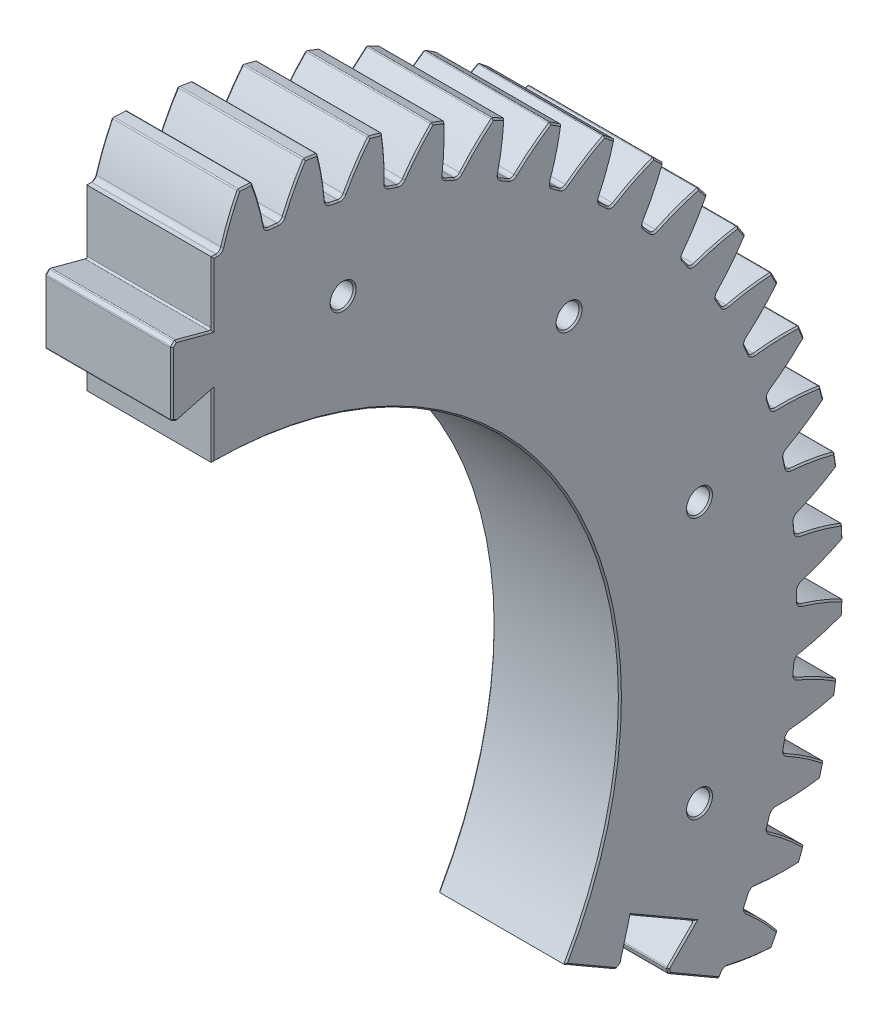
from build123d import *

# Parameters (mm, degrees)
BASPROSKE_W             = 25
BASPROSKE_H             = 124
TOOTHCUT_DEPTH          = 178.135541324
TEETHCUTS_COUNT         = 60
TEETHCUTS_ANGLE         = 354
BORSKE_R                = 80
BORE_DEPTH              = 50.0000508
ENL_V_MAT_EXTRU_1_DEPTH = 177.985481427
ESQUISSE3_R             = 2.25
ENL_V_MAT_EXTRU_2_DEPTH = 177.985481427
CONG_1_R                = 1
CHANFREIN1_SIZE         = 0.3
ESQUISSE4_R             = 6.75
ENL_V_MAT_EXTRU_3_DEPTH = 5.2
CHANFREIN2_SIZE         = 0.3
CHANFREIN3_SIZE         = 0.816496581
CHANFREIN3_SIZE_2       = 1
CONG_2_R                = 0.3
CHANFREIN4_SIZE         = 0.3
CONG_3_R                = 0.3


with BuildPart() as part:
    # BasProSke → Base-Revolve (revolve)
    with BuildSketch(Plane(origin=(0, 0, 0), x_dir=(1, 0, 0), z_dir=(0, 1, 0)), mode=Mode.PRIVATE) as base_revolve_sk:
        with Locations((12.5, 62)):
            Rectangle(BASPROSKE_W, BASPROSKE_H)
    revolve(base_revolve_sk.sketch.rotate(Axis((-10, 0, 0), (1, 0, 0)), 180), axis=Axis((-10, 0, 0), (1, 0, 0)))

    # TooCutSke → ToothCut (cut, through all)
    with BuildSketch(Plane(origin=(0, 0, 0), x_dir=(0, 0, -1), z_dir=(1, 0, 0))):
        with BuildLine():
            ThreePointArc((1.679508819, 114.986735109), (0, 114.999), (-1.679508819, 114.986735109))
            ThreePointArc((-1.679508819, 114.986735109), (-3.199847673, 119.539525214), (-5.167287996, 123.917710518))
            ThreePointArc((-5.167287996, 123.917710518), (0, 124.0254), (5.167287996, 123.917710518))
            ThreePointArc((5.167287996, 123.917710518), (3.199847673, 119.539525214), (1.679508819, 114.986735109))
        make_face()
    toothcut = extrude(amount=TOOTHCUT_DEPTH, mode=Mode.SUBTRACT)

    # TeethCuts: ToothCut ×60 about axis
    teethcuts_axis = Axis((-10, 0, 0), (1, 0, 0))
    for i in range(1, TEETHCUTS_COUNT):
        add(toothcut.rotate(teethcuts_axis, i * TEETHCUTS_ANGLE / (TEETHCUTS_COUNT - 1)), mode=Mode.SUBTRACT)

    # BorSke → Bore (cut, symmetric)
    with BuildSketch(Plane(origin=(0, 0, 0), x_dir=(0, 0, -1), z_dir=(1, 0, 0))):
        with Locations(Location((0, 0, 0), (0, 0, 180))):
            Circle(BORSKE_R)
    extrude(amount=BORE_DEPTH, both=True, mode=Mode.SUBTRACT)

    # Esquisse2 → Enlèv. mat.-Extru.1 (cut, through all)
    with BuildSketch(Plane(origin=(25, 0, 0), x_dir=(0, 0, -1), z_dir=(1, 0, 0))):
        Polygon((0, 114.999), (0, 102.5), (-8, 104.643593539), (-8, 90.356406461), (0, 92.5), (0, 0), (80.02074731, -46.2), (82.204533228, -38.05), (94.82042051, -45.333785918), (88.854206428, -51.3), (114.723136611, -66.235433804), (38.300830577, -156.661592329), (-106.341599395, -136.652334384), (-159.895789778, -12.477233605), (-109.242981723, 114.999), (0, 136.399070749), align=None)
    extrude(amount=-ENL_V_MAT_EXTRU_1_DEPTH, mode=Mode.SUBTRACT)

    # Esquisse3 → Enlèv. mat.-Extru.2 (cut, through all)
    with BuildSketch(Plane(origin=(25, 0, 0), x_dir=(0, 0, -1), z_dir=(1, 0, 0))):
        with Locations((25.623085465, 95.626656803)):
            Circle(ESQUISSE3_R)
        with Locations((70.003571337, 70.003571337)):
            Circle(ESQUISSE3_R)
        with Locations((95.626656803, 25.623085465)):
            Circle(ESQUISSE3_R)
        with Locations((95.626656803, -25.623085465)):
            Circle(ESQUISSE3_R)
    extrude(amount=-ENL_V_MAT_EXTRU_2_DEPTH, mode=Mode.SUBTRACT)

    # Congé1
    cong_1_edges = [part.edges().sort_by_distance(p)[0] for p in [
        (12.5, 114.986735109, -1.679508819),
        (12.5, -13.689695011, -114.181269267),
        (12.5, -10.349078424, -114.532382219),
        (12.5, -25.54989404, -112.124809545),
        (12.5, -22.264278997, -112.823188582),
        (12.5, -37.130163083, -108.839886946),
        (12.5, -33.93554747, -109.87788048),
        (12.5, -48.303626289, -104.362491769),
        (12.5, -45.235010984, -105.728727327),
        (12.5, -56.038870252, -100.421188112),
        (12.5, 114.181269267, -13.689695011),
        (12.5, 114.532382219, -10.349078424),
        (12.5, 112.124809545, -25.54989404),
        (12.5, 112.823188582, -22.264278997),
        (12.5, 108.839886946, -37.130163083),
        (12.5, 109.87788048, -33.93554747),
        (12.5, 104.362491769, -48.303626289),
        (12.5, 105.728727327, -45.235010984),
        (12.5, 84.327986441, -78.189262075),
        (12.5, 86.575607949, -75.693025499),
        (12.5, 75.693025499, -86.575607949),
        (12.5, 78.189262075, -84.327986441),
        (12.5, 98.741679294, -58.947864858),
        (12.5, 100.421188112, -56.038870252),
        (12.5, 92.039032317, -68.946258283),
        (12.5, 94.013413346, -66.22875593),
        (12.5, 56.038870252, -100.421188112),
        (12.5, 58.947864858, -98.741679294),
        (12.5, 66.22875593, -94.013413346),
        (12.5, 68.946258283, -92.039032317),
        (12.5, 45.235010984, -105.728727327),
        (12.5, 48.303626289, -104.362491769),
        (12.5, 33.93554747, -109.87788048),
        (12.5, 37.130163083, -108.839886946),
        (12.5, 22.264278997, -112.823188582),
        (12.5, 25.54989404, -112.124809545),
        (12.5, 10.349078424, -114.532382219),
        (12.5, 13.689695011, -114.181269267),
        (12.5, -1.679508819, -114.986735109),
        (12.5, 1.679508819, -114.986735109),
    ]]
    fillet(cong_1_edges, radius=CONG_1_R)

    # Chanfrein1
    chanfrein1_edges = [part.edges().sort_by_distance(p)[0] for p in [
        (25, 123.83006231, -6.489658574),
        (25, 40, -69.282032303),
        (0, 40, -69.282032303),
        (0, 114.998077734, -0.460563305),
        (25, 114.998077734, -0.460563305),
        (0, 86.25, 0),
        (0, -43.1, -74.651389806),
        (0, -42.125, -81.112640269),
        (0, -41.691892959, -88.512476869),
        (0, -48.316892959, -91.837313469),
        (0, -54.39975, -94.223130919),
        (0, 108.7495, 0),
        (0, 103.57179677, 4),
        (0, 97.5, 8),
        (0, 91.42820323, 4),
        (25, -54.39975, -94.223130919),
        (25, -48.316892959, -91.837313469),
        (25, -41.691892959, -88.512476869),
        (25, -42.125, -81.112640269),
        (25, -43.1, -74.651389806),
        (25, 86.25, 0),
        (25, 91.42820323, 4),
        (25, 97.5, 8),
        (25, 103.57179677, 4),
        (25, 108.7495, 0),
        (0, 95.626656803, -23.373085465),
        (25, 95.626656803, -23.373085465),
        (0, 70.003571337, -67.753571337),
        (25, 70.003571337, -67.753571337),
        (0, 25.623085465, -93.376656803),
        (25, 25.623085465, -93.376656803),
        (0, -25.623085465, -93.376656803),
        (25, -25.623085465, -93.376656803),
        (0, 119.877140989, -3.333168888),
        (25, 119.877140989, -3.333168888),
        (0, 119.568852489, -9.215663888),
        (0, 114.369023445, -12.020668747),
        (25, 114.369023445, -12.020668747),
        (0, 118.872030446, -15.845482769),
        (25, 118.872030446, -15.845482769),
        (0, 117.95054262, -21.663527922),
        (0, 112.485995937, -23.909636532),
        (25, 112.485995937, -23.909636532),
        (0, 116.564533062, -28.184190224),
        (25, 116.564533062, -28.184190224),
        (0, 115.039941924, -33.874041812),
        (0, 109.370548317, -35.536645336),
        (25, 109.370548317, -35.536645336),
        (0, 112.979930261, -40.214105794),
        (25, 112.979930261, -40.214105794),
        (0, 110.86893955, -45.71342461),
        (0, 105.056814083, -46.774307217),
        (25, 105.056814083, -46.774307217),
        (0, 108.157495701, -51.803427205),
        (25, 108.157495701, -51.803427205),
        (0, 105.483233874, -57.051961562),
        (0, 99.59205541, -57.4995),
        (25, 99.59205541, -57.4995),
        (0, 102.150064985, -62.825179427),
        (25, 102.150064985, -62.825179427),
        (0, 98.941831813, -67.765425285),
        (0, 93.036145336, -67.594716228),
        (25, 93.036145336, -67.594716228),
        (0, 95.023456781, -73.158605836),
        (25, 95.023456781, -73.158605836),
        (0, 91.316402338, -77.736436827),
        (0, 85.460911785, -76.949350601),
        (25, 85.460911785, -76.949350601),
        (0, 86.8557517, -82.69049125),
        (25, 86.8557517, -82.69049125),
        (0, 82.69049125, -86.8557517),
        (0, 76.949350601, -85.460911785),
        (25, 76.949350601, -85.460911785),
        (0, 77.736436827, -91.316402338),
        (25, 77.736436827, -91.316402338),
        (0, 73.158605836, -95.023456781),
        (0, 67.594716228, -93.036145336),
        (25, 67.594716228, -93.036145336),
        (0, 67.765425285, -98.941831813),
        (25, 67.765425285, -98.941831813),
        (0, 62.825179427, -102.150064985),
        (0, 57.4995, -99.59205541),
        (25, 57.4995, -99.59205541),
        (0, 57.051961562, -105.483233874),
        (25, 57.051961562, -105.483233874),
        (0, 51.803427205, -108.157495701),
        (0, 46.774307217, -105.056814083),
        (25, 46.774307217, -105.056814083),
        (0, 45.71342461, -110.86893955),
        (25, 45.71342461, -110.86893955),
        (0, 40.214105794, -112.979930261),
        (0, 35.536645336, -109.370548317),
        (25, 35.536645336, -109.370548317),
        (0, 33.874041812, -115.039941924),
        (25, 33.874041812, -115.039941924),
        (0, 28.184190224, -116.564533062),
        (0, 23.909636532, -112.485995937),
        (25, 23.909636532, -112.485995937),
        (0, 21.663527922, -117.95054262),
        (25, 21.663527922, -117.95054262),
        (0, 15.845482769, -118.872030446),
        (0, 12.020668747, -114.369023445),
        (25, 12.020668747, -114.369023445),
        (0, 9.215663888, -119.568852489),
        (25, 9.215663888, -119.568852489),
        (0, 3.333168888, -119.877140989),
        (0, 0, -114.999),
        (25, 0, -114.999),
        (0, -3.333168888, -119.877140989),
        (25, -3.333168888, -119.877140989),
        (0, -9.215663888, -119.568852489),
        (0, -12.020668747, -114.369023445),
        (25, -12.020668747, -114.369023445),
        (0, -15.845482769, -118.872030446),
        (25, -15.845482769, -118.872030446),
        (0, -21.663527922, -117.95054262),
        (0, -23.909636532, -112.485995937),
        (25, -23.909636532, -112.485995937),
        (0, -28.184190224, -116.564533062),
        (25, -28.184190224, -116.564533062),
        (0, -33.874041812, -115.039941924),
        (0, -35.536645336, -109.370548317),
        (25, -35.536645336, -109.370548317),
        (0, -40.214105794, -112.979930261),
        (25, -40.214105794, -112.979930261),
        (0, -57.051961562, -105.483233874),
        (0, -57.100179344, -99.821538356),
        (25, -57.100179344, -99.821538356),
        (0, -45.71342461, -110.86893955),
        (0, -46.774307217, -105.056814083),
        (25, -46.774307217, -105.056814083),
        (0, -51.803427205, -108.157495701),
        (25, -51.803427205, -108.157495701),
        (0, 115.191635289, -1.524239934),
        (25, 115.191635289, -1.524239934),
        (0, 114.719929916, -10.524914629),
        (25, 114.719929916, -10.524914629),
        (0, 114.401277, -13.556694607),
        (25, 114.401277, -13.556694607),
        (0, 112.991328985, -22.458756026),
        (25, 112.991328985, -22.458756026),
        (0, 112.357514381, -25.440619296),
        (25, 112.357514381, -25.440619296),
        (0, 110.024771408, -34.146534592),
        (25, 110.024771408, -34.146534592),
        (0, 109.082739321, -37.045811236),
        (25, 109.082739321, -37.045811236),
        (0, 105.852759411, -45.460196579),
        (25, 105.852759411, -45.460196579),
        (0, 104.612830943, -48.245121516),
        (25, 104.612830943, -48.245121516),
        (0, 100.521002431, -56.27578714),
        (25, 100.521002431, -56.27578714),
        (0, 98.996762497, -58.915848149),
        (25, 98.996762497, -58.915848149),
        (0, 94.087916313, -66.4748084),
        (25, 94.087916313, -66.4748084),
        (0, 92.296064804, -68.941080421),
        (25, 92.296064804, -68.941080421),
        (0, 86.623983295, -75.945517748),
        (25, 86.623983295, -75.945517748),
        (0, 84.584152112, -78.210979789),
        (25, 84.584152112, -78.210979789),
        (0, 78.210979789, -84.584152112),
        (25, 78.210979789, -84.584152112),
        (0, 75.945517748, -86.623983295),
        (25, 75.945517748, -86.623983295),
        (0, 68.941080421, -92.296064804),
        (25, 68.941080421, -92.296064804),
        (0, 66.4748084, -94.087916313),
        (25, 66.4748084, -94.087916313),
        (0, 58.915848149, -98.996762497),
        (25, 58.915848149, -98.996762497),
        (0, 56.27578714, -100.521002431),
        (25, 56.27578714, -100.521002431),
        (0, 48.245121516, -104.612830943),
        (25, 48.245121516, -104.612830943),
        (0, 45.460196579, -105.852759411),
        (25, 45.460196579, -105.852759411),
        (0, 37.045811236, -109.082739321),
        (25, 37.045811236, -109.082739321),
        (0, 34.146534592, -110.024771408),
        (25, 34.146534592, -110.024771408),
        (0, 25.440619296, -112.357514381),
        (25, 25.440619296, -112.357514381),
        (0, 22.458756026, -112.991328985),
        (25, 22.458756026, -112.991328985),
        (0, 13.556694607, -114.401277),
        (25, 13.556694607, -114.401277),
        (0, 10.524914629, -114.719929916),
        (25, 10.524914629, -114.719929916),
        (0, 1.524239934, -115.191635289),
        (25, 1.524239934, -115.191635289),
        (0, -1.524239934, -115.191635289),
        (25, -1.524239934, -115.191635289),
        (0, -10.524914629, -114.719929916),
        (25, -10.524914629, -114.719929916),
        (0, -13.556694607, -114.401277),
        (25, -13.556694607, -114.401277),
        (0, -22.458756026, -112.991328985),
        (25, -22.458756026, -112.991328985),
        (0, -25.440619296, -112.357514381),
        (25, -25.440619296, -112.357514381),
        (0, -34.146534592, -110.024771408),
        (25, -34.146534592, -110.024771408),
        (0, -37.045811236, -109.082739321),
        (25, -37.045811236, -109.082739321),
        (0, -56.27578714, -100.521002431),
        (25, -56.27578714, -100.521002431),
        (0, -45.460196579, -105.852759411),
        (25, -45.460196579, -105.852759411),
        (0, -48.245121516, -104.612830943),
        (25, -48.245121516, -104.612830943),
        (25, 122.473354234, -19.397873665),
        (25, 119.77480246, -32.093561593),
        (25, 115.763972886, -44.437625744),
        (25, 110.484808999, -56.294821968),
        (25, 103.995150425, -67.535240342),
        (25, 96.366099221, -78.03572849),
        (25, 87.681240867, -87.681240867),
        (25, 78.03572849, -96.366099221),
        (25, 67.535240342, -103.995150425),
        (25, 56.294821968, -110.484808999),
        (25, 44.437625744, -115.763972886),
        (25, 32.093561593, -119.77480246),
        (25, 19.397873665, -122.473354234),
        (25, 6.489658574, -123.83006231),
        (25, -6.489658574, -123.83006231),
        (25, -19.397873665, -122.473354234),
        (25, -32.093561593, -119.77480246),
        (25, -44.437625744, -115.763972886),
        (25, -56.294821968, -110.484808999),
        (0, 122.473354234, -19.397873665),
        (0, 119.77480246, -32.093561593),
        (0, 115.763972886, -44.437625744),
        (0, 110.484808999, -56.294821968),
        (0, 103.995150425, -67.535240342),
        (0, 96.366099221, -78.03572849),
        (0, 87.681240867, -87.681240867),
        (0, 78.03572849, -96.366099221),
        (0, 67.535240342, -103.995150425),
        (0, 56.294821968, -110.484808999),
        (0, 44.437625744, -115.763972886),
        (0, 32.093561593, -119.77480246),
        (0, 19.397873665, -122.473354234),
        (0, 6.489658574, -123.83006231),
        (0, -6.489658574, -123.83006231),
        (0, -19.397873665, -122.473354234),
        (0, -32.093561593, -119.77480246),
        (0, -44.437625744, -115.763972886),
        (0, -56.294821968, -110.484808999),
        (25, -9.215663888, -119.568852489),
        (25, -21.663527922, -117.95054262),
        (25, -33.874041812, -115.039941924),
        (25, -45.71342461, -110.86893955),
        (25, -57.051961562, -105.483233874),
        (25, 119.568852489, -9.215663888),
        (25, 117.95054262, -21.663527922),
        (25, 115.039941924, -33.874041812),
        (25, 110.86893955, -45.71342461),
        (25, 91.316402338, -77.736436827),
        (25, 82.69049125, -86.8557517),
        (25, 105.483233874, -57.051961562),
        (25, 98.941831813, -67.765425285),
        (25, 62.825179427, -102.150064985),
        (25, 73.158605836, -95.023456781),
        (25, 51.803427205, -108.157495701),
        (25, 40.214105794, -112.979930261),
        (25, 28.184190224, -116.564533062),
        (25, 15.845482769, -118.872030446),
        (25, 3.333168888, -119.877140989),
        (0, 123.83006231, -6.489658574),
    ]]
    chamfer(chanfrein1_edges, length=CHANFREIN1_SIZE)

    # Esquisse4 → Enlèv. mat.-Extru.3 (cut)
    with BuildSketch(Plane.ZY):
        with Locations((-95.626656803, -25.623085465)):
            Circle(ESQUISSE4_R)
        with Locations((-95.626656803, 25.623085465)):
            Circle(ESQUISSE4_R)
        with Locations((-70.003571337, 70.003571337)):
            Circle(ESQUISSE4_R)
        with Locations((-25.623085465, 95.626656803)):
            Circle(ESQUISSE4_R)
    extrude(amount=-ENL_V_MAT_EXTRU_3_DEPTH, mode=Mode.SUBTRACT)

    # Chanfrein2
    chanfrein2_edges = [part.edges().sort_by_distance(p)[0] for p in [
        (0, -25.623085465, -102.376656803),
        (0, 25.623085465, -102.376656803),
        (0, 70.003571337, -76.753571337),
        (0, 95.626656803, -32.373085465),
    ]]
    chamfer(chanfrein2_edges, length=CHANFREIN2_SIZE)

    # Chanfrein3
    # the kernel refuses this chamfer: 1, 0.816496581 mm, written as the material it takes off along each edge
    with BuildSketch(Plane(origin=(27.271682988, -46.2, -80.02074731), x_dir=(0, 0.46373866025064403, 0.8859720396202906), z_dir=(-1, 0, 0)), Plane(origin=(27.271682988, -51.3, -88.854206428), x_dir=(0, 0.7357588772160352, -0.6772435858668572), z_dir=(-1, 0, 0))) as chanfrein3_piece_1:
        Polygon((CHANFREIN3_SIZE * 0.999143623391, CHANFREIN3_SIZE * 0.0413765593125), (CHANFREIN3_SIZE_2 * 0.218630711303, CHANFREIN3_SIZE_2 * 0.975807671662), (0, 0), align=None)
    extrude(amount=29.543365976, mode=Mode.SUBTRACT)
    with BuildSketch(Plane(origin=(27.271682988, 90.356406461, 8), x_dir=(0, 0.23216221266391973, -0.9726770825978132), z_dir=(-1, 0, 0)), Plane(origin=(27.271682988, 104.643593539, 8), x_dir=(0, -0.9996219169112968, 0.02749587661058574), z_dir=(-1, 0, 0))) as chanfrein3_piece_2:
        Polygon((CHANFREIN3_SIZE_2 * 0.999621916911, -CHANFREIN3_SIZE_2 * 0.0274958766106), (CHANFREIN3_SIZE * 0.232162212643, -CHANFREIN3_SIZE * 0.972677082512), (0, 0), align=None)
    extrude(amount=29.543365976, mode=Mode.SUBTRACT)

    # Congé2
    cong_2_edges = [part.edges().sort_by_distance(p)[0] for p in [
        (12.5, 92.5, 0),
        (12.5, 102.5, 0),
        (12.5, -45.333785918, -94.82042051),
        (12.5, -38.05, -82.204533228),
        (12.5, -45.79175171, -79.313640528),
        (12.5, -45.234074174, -80.279566355),
        (12.5, -50.722649731, -89.431556697),
        (12.5, -51.8, -89.720231832),
        (12.5, 103.643593539, 8),
        (12.5, 91.172903041, 8),
        (12.5, 90.615225506, 7.034074174),
        (12.5, 104.432268674, 7.211324865),
    ]]
    fillet(cong_2_edges, radius=CONG_2_R)

    # Chanfrein4
    # the kernel refuses this chamfer: 0.3 mm, written as the material it takes off along each edge
    with BuildSketch(Plane(origin=(0, -52.135408883, -89.810104372), x_dir=(-0.027495876610585814, 0.2587211899982335, -0.9655606260692869), z_dir=(0, 0.9659258262891487, 0.25881904510222103)), Plane(origin=(0, -45.06045376, -80.580285733), x_dir=(-0.027495876610586938, 0.8656979742251878, 0.49981095845511586), z_dir=(0, -0.4999999999994673, 0.8660254037847464)), Plane(origin=(25, 90.441605092, 6.733354796), x_dir=(-0.9996219169112971, -0.023812127644076485, 0.013747938305288431), z_dir=(0, 0.5000000000000858, 0.8660254037843892)), Plane(origin=(25, 103.398057195, 8.245536344), x_dir=(-0.999621916911297, 0.01944252080602017, 0.0194425208059982), z_dir=(0, 0.707106781186148, -0.707106781186947))) as chanfrein4_piece_1:
        Polygon((CHANFREIN4_SIZE * 0.999621916911, -CHANFREIN4_SIZE * 0.0274958766106), (-CHANFREIN4_SIZE * 0.0274958766106, -CHANFREIN4_SIZE * 0.999621916911), (0, 0), align=None)
    extrude(amount=1.887690634, mode=Mode.SUBTRACT)
    with BuildSketch(Plane(origin=(25, -50.312039748, -89.321534084), x_dir=(-0.9996219169112962, -0.007116456528604932, 0.026558977334641815), z_dir=(0, -0.9659258262891487, -0.25881904510222103)), Plane(origin=(25, -46.004299077, -78.945497689), x_dir=(-0.9996219169112968, -0.023812127644094662, -0.013747938305276252), z_dir=(0, 0.4999999999994673, -0.8660254037847464)), Plane(origin=(0, 91.385450409, 8.368142839), x_dir=(-0.02749587661058581, 0.8656979742248309, -0.4998109584557341), z_dir=(0, -0.5000000000000858, -0.8660254037843892)), Plane(origin=(0, 104.732856044, 6.910737496), x_dir=(-0.027495876610586348, -0.7068394360710728, -0.7068394360702741), z_dir=(0, -0.707106781186148, 0.707106781186947))) as chanfrein4_piece_2:
        Polygon((CHANFREIN4_SIZE * 0.999621916911, CHANFREIN4_SIZE * 0.0274958766106), (-CHANFREIN4_SIZE * 0.0274958766106, CHANFREIN4_SIZE * 0.999621916911), (0, 0), align=None)
    extrude(amount=1.887690634, mode=Mode.SUBTRACT)

    # Congé3
    cong_3_edges = [part.edges().sort_by_distance(p)[0] for p in [
        (12.5, 123.892817863, -5.154578743),
        (12.5, 123.752920238, -7.82398444),
        (12.5, 122.675319849, -18.076667282),
        (12.5, 122.257159723, -20.716826412),
        (12.5, 120.113765359, -30.800704072),
        (12.5, 119.421924181, -33.382690498),
        (12.5, 116.23621932, -43.187281903),
        (12.5, 115.278277047, -45.682806842),
        (12.5, 111.085164939, -55.100690835),
        (12.5, 109.871616987, -57.482412794),
        (12.5, 104.717038244, -66.410405069),
        (12.5, 103.261180499, -68.652229403),
        (12.5, 97.201609765, -76.992513007),
        (12.5, 95.519392908, -79.06987782),
        (12.5, 88.621220109, -86.73107486),
        (12.5, 86.73107486, -88.621220109),
        (12.5, 79.06987782, -95.519392908),
        (12.5, 76.992513007, -97.201609765),
        (12.5, 68.652229403, -103.261180499),
        (12.5, 66.410405069, -104.717038244),
        (12.5, 57.482412794, -109.871616987),
        (12.5, 55.100690835, -111.085164939),
        (12.5, 45.682806842, -115.278277047),
        (12.5, 43.187281903, -116.23621932),
        (12.5, 33.382690498, -119.421924181),
        (12.5, 30.800704072, -120.113765359),
        (12.5, 20.716826412, -122.257159723),
        (12.5, 18.076667282, -122.675319849),
        (12.5, 7.82398444, -123.752920238),
        (12.5, 5.154578743, -123.892817863),
        (12.5, -5.154578743, -123.892817863),
        (12.5, -7.82398444, -123.752920238),
        (12.5, -18.076667282, -122.675319849),
        (12.5, -20.716826412, -122.257159723),
        (12.5, -30.800704072, -120.113765359),
        (12.5, -33.382690498, -119.421924181),
        (12.5, -43.187281903, -116.23621932),
        (12.5, -45.682806842, -115.278277047),
        (12.5, -55.100690835, -111.085164939),
        (12.5, -57.482412794, -109.871616987),
    ]]
    fillet(cong_3_edges, radius=CONG_3_R)


solid = part.part
